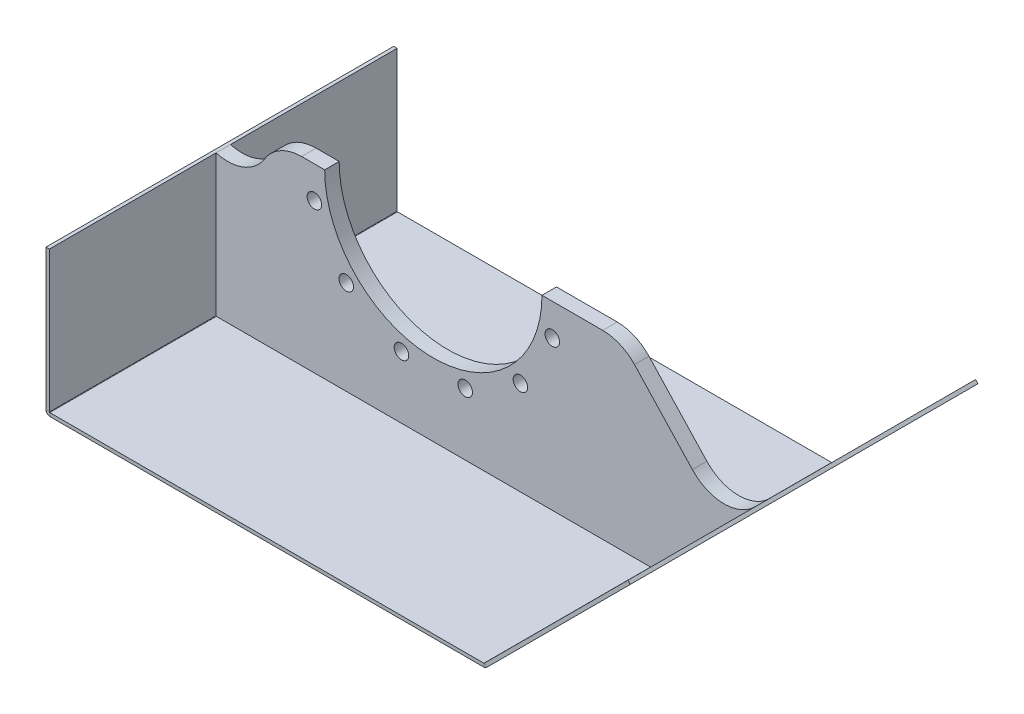
from build123d import *

# Parameters (mm, degrees)
SKETCH1_R                    = 241.3
SKETCH1_R_2                  = 190.5
SKETCH1_R_3                  = 12.7
BOSS_EXTRUDE1_DEPTH          = 25.4
SKETCH19_W                   = 762
SKETCH19_H                   = 609.6
BASE_FLANGE1_DEPTH           = 6
EDGE_FLANGE1_STRIP_CUT_DEPTH = 609.6
EDGE_FLANGE1_DEPTH           = 609.6
EDGE_FLANGE2_STRIP_W         = 25.4732
EDGE_FLANGE2_STRIP_H         = 6
EDGE_FLANGE2_STRIP_CUT_DEPTH = 609.6
EDGE_FLANGE2_DEPTH           = 609.6
BOSS_EXTRUDE2_DEPTH          = 12.7
BOSS_EXTRUDE2_DEPTH_BACK     = 12.7
FILLET1_R                    = 76.2
SKETCH30_R                   = 12.7
CUT_EXTRUDE1_DEPTH           = 783.174585068
FILLET3_R                    = 76.2


# Sheet-metal steps are written as plain solids
with BuildPart() as part:
    # Sketch1 → Boss-Extrude1 (new body)
    with BuildSketch(Plane.XY):
        Circle(SKETCH1_R)
        Circle(SKETCH1_R_2, mode=Mode.SUBTRACT)
        with Locations((55.879031838, 208.543385896)):
            Circle(SKETCH1_R_3, mode=Mode.SUBTRACT)
        with Locations((152.664354058, 152.664354058)):
            Circle(SKETCH1_R_3, mode=Mode.SUBTRACT)
        with Locations((208.543385896, 55.879031838)):
            Circle(SKETCH1_R_3, mode=Mode.SUBTRACT)
        with Locations((208.543385896, -55.879031838)):
            Circle(SKETCH1_R_3, mode=Mode.SUBTRACT)
        with Locations((152.664354058, -152.664354058)):
            Circle(SKETCH1_R_3, mode=Mode.SUBTRACT)
        with Locations((55.879031838, -208.543385896)):
            Circle(SKETCH1_R_3, mode=Mode.SUBTRACT)
        with Locations((-55.879031838, -208.543385896)):
            Circle(SKETCH1_R_3, mode=Mode.SUBTRACT)
        with Locations((-152.664354058, -152.664354058)):
            Circle(SKETCH1_R_3, mode=Mode.SUBTRACT)
        with Locations((-208.543385896, -55.879031838)):
            Circle(SKETCH1_R_3, mode=Mode.SUBTRACT)
        with Locations((-208.543385896, 55.879031838)):
            Circle(SKETCH1_R_3, mode=Mode.SUBTRACT)
        with Locations((-152.664354058, 152.664354058)):
            Circle(SKETCH1_R_3, mode=Mode.SUBTRACT)
        with Locations((-55.879031838, 208.543385896)):
            Circle(SKETCH1_R_3, mode=Mode.SUBTRACT)
    extrude(amount=BOSS_EXTRUDE1_DEPTH)



with BuildPart() as body_2:
    # Sketch19 → Base-Flange1 (new body)
    with BuildSketch(Plane(origin=(0, -317.5, 0), x_dir=(1, 0, 0), z_dir=(0, 1, 0))):
        with Locations((0, -12.7)):
            Rectangle(SKETCH19_W, SKETCH19_H)
    extrude(amount=-BASE_FLANGE1_DEPTH)

    # Edge-Flange1 strip (across the edge) → Edge-Flange1 strip cut (cut)
    with BuildSketch(Plane(origin=(381, -317.5, 317.5), x_dir=(-0.7071067811865438, 0.7071067811865512, 0), z_dir=(0, 0, -1))):
        Polygon((-22.039168001, 13.553886626), (-4.026895542, -4.458385832), (0.215745145, -0.215745145), (-17.796527314, 17.796527314), align=None)
    extrude(amount=EDGE_FLANGE1_STRIP_CUT_DEPTH, mode=Mode.SUBTRACT)

    # Edge-Flange1 section (across the edge) → Edge-Flange1 (add)
    with BuildSketch(Plane(origin=(381, -317.5, 317.5), x_dir=(-0.7071067811865438, 0.7071067811865512, 0), z_dir=(0, 0, -1))):
        with BuildLine():
            Line((-6, 0.30510971), (-6, 356.670718626))
            Line((-6, 356.670718626), (0, 356.670718626))
            Line((0, 356.670718626), (0, 0.30510971))
            ThreePointArc((0, 0.30510971), (0.056070336, 0.023225094), (0.215745145, -0.215745145))
            Line((0.215745145, -0.215745145), (-4.026895542, -4.458385832))
            ThreePointArc((-4.026895542, -4.458385832), (-5.487206859, -2.2728755), (-6, 0.30510971))
        make_face()
    extrude(amount=EDGE_FLANGE1_DEPTH)

    # Edge-Flange2 strip (across the edge) → Edge-Flange2 strip cut (cut)
    with BuildSketch(Plane(origin=(-381, -317.5, -292.1), x_dir=(1, 0, 0), z_dir=(0, 0, 1))):
        with Locations((-12, -3)):
            Rectangle(EDGE_FLANGE2_STRIP_W, EDGE_FLANGE2_STRIP_H)
    extrude(amount=EDGE_FLANGE2_STRIP_CUT_DEPTH, mode=Mode.SUBTRACT)

    # Edge-Flange2 section (across the edge) → Edge-Flange2 (add)
    with BuildSketch(Plane(origin=(-381, -317.5, -292.1), x_dir=(1, 0, 0), z_dir=(0, 0, 1))):
        with BuildLine():
            Line((-6, 0.7366), (-6, 248))
            Line((-6, 248), (0, 248))
            Line((0, 248), (0, 0.7366))
            ThreePointArc((0, 0.7366), (0.215745145, 0.215745145), (0.7366, 0))
            Line((0.7366, 0), (0.7366, -6))
            ThreePointArc((0.7366, -6), (-4.026895542, -4.026895542), (-6, 0.7366))
        make_face()
    extrude(amount=EDGE_FLANGE2_DEPTH)


with BuildPart() as part_1:
    add(part.part)

    add(body_2.part)  # Boss-Extrude2 merges body 2
    # Sketch2 → Boss-Extrude2 (add, two sides: drawn at the far end of the back side and taken through both)
    with BuildSketch(Plane(origin=(0, 0, 12.7), x_dir=(-1, 0, 0), z_dir=(0, 0, -1)).offset(-BOSS_EXTRUDE2_DEPTH_BACK)):
        with BuildLine():
            Line((-176.371629871, 164.677679655), (-508, -190.5))
            Line((-508, -190.5), (-381, -317.5))
            Line((-381, -317.5), (381, -317.5))
            Line((381, -317.5), (381, -190.5))
            Line((381, -190.5), (211.187529283, 116.728391899))
            ThreePointArc((211.187529283, 116.728391899), (-29.628031694, -239.474152547), (-176.371629871, 164.677679655))
        make_face()
    extrude(amount=BOSS_EXTRUDE2_DEPTH + BOSS_EXTRUDE2_DEPTH_BACK)

    # Fillet1
    # the kernel refuses this fillet: 76.2 mm, written as the material it adds along each edge
    with BuildSketch(Plane(origin=(-381, -190.5, 0), x_dir=(0, 1, 0), z_dir=(0, 0, 1))) as fillet1_piece_1:
        with BuildLine():
            CenterArc((194.419807723, -20.395387566), FILLET1_R, 164.475167034, 76.594355804)
            Line((157.558210281, -87.086186287), (156.820978332, -88.420002261))
            Line((156.820978332, -88.420002261), (-0.737231949, -1.333815974))
            Line((-0.737231949, -1.333815974), (0, 1.524))
            ThreePointArc((0, 1.524), (60.5, 1.524), (119.531603846, 0.407907751))
            Line((119.531603846, 0.407907751), (121, 0))
        make_face()
    extrude(amount=25.4)
    with BuildSketch(Plane(origin=(508, -190.5, 25.4), x_dir=(0.7071067811865509, 0.707106781186544, 0), z_dir=(0, 0, -1))) as fillet1_piece_2:
        with BuildLine():
            CenterArc((FILLET1_R * 1.03487581695, -FILLET1_R), FILLET1_R, 90, 91.963796982)
            Line((FILLET1_R * 0.0354631377737, -FILLET1_R * 1.03426801283), (FILLET1_R * 0.0154748841901, -FILLET1_R * 1.03495337309))
            Line((FILLET1_R * 0.0154748841901, -FILLET1_R * 1.03495337309), (-FILLET1_R * 0.020697516339, FILLET1_R * 0.02))
            Line((-FILLET1_R * 0.020697516339, FILLET1_R * 0.02), (FILLET1_R * 1.03487581695, FILLET1_R * 0.02))
            Line((FILLET1_R * 1.03487581695, FILLET1_R * 0.02), (FILLET1_R * 1.03487581695, 0))
        make_face()
    extrude(amount=25.4)

    # Sketch30 → Cut-Extrude1 (cut, through all)
    # profile 1 of 3: a face of its own
    with BuildSketch(Plane(origin=(0, 0, 0), x_dir=(-1, 0, 0), z_dir=(0, 0, -1))):
        with BuildLine():
            Line((-330.130702101, 0), (-241.3, 0))
            ThreePointArc((-241.3, 0), (-224.481808047, 88.507671171), (-176.371629871, 164.677679655))
            Line((-176.371629871, 164.677679655), (-330.130702101, 0))
        make_face()
    # profile 2 of 3: a face of its own
    with BuildSketch(Plane(origin=(0, 0, 0), x_dir=(-1, 0, 0), z_dir=(0, 0, -1))):
        with BuildLine():
            Line((-241.3, 0), (-190.5, 0))
            ThreePointArc((-190.5, 0), (0, 190.5), (190.5, 0))
            Line((190.5, 0), (241.3, 0))
            ThreePointArc((241.3, 0), (233.650637508, 60.274949954), (211.187529283, 116.728391899))
            ThreePointArc((211.187529283, 116.728391899), (29.628031694, 239.474152547), (-176.371629871, 164.677679655))
            ThreePointArc((-176.371629871, 164.677679655), (-224.481808047, 88.507671171), (-241.3, 0))
        make_face()
        with Locations((-208.543385896, 55.879031838)):
            Circle(SKETCH30_R, mode=Mode.SUBTRACT)
        with Locations((-152.664354058, 152.664354058)):
            Circle(SKETCH30_R, mode=Mode.SUBTRACT)
        with Locations((-55.879031838, 208.543385896)):
            Circle(SKETCH30_R, mode=Mode.SUBTRACT)
        with Locations((208.543385896, 55.879031838)):
            Circle(SKETCH30_R, mode=Mode.SUBTRACT)
        with Locations((55.879031838, 208.543385896)):
            Circle(SKETCH30_R, mode=Mode.SUBTRACT)
        with Locations((152.664354058, 152.664354058)):
            Circle(SKETCH30_R, mode=Mode.SUBTRACT)
    # profile 3 of 3: a face of its own
    with BuildSketch(Plane(origin=(0, 0, 0), x_dir=(-1, 0, 0), z_dir=(0, 0, -1))):
        with BuildLine():
            ThreePointArc((211.187529283, 116.728391899), (233.650637508, 60.274949954), (241.3, 0))
            Line((241.3, 0), (275.706099682, 0))
            Line((275.706099682, 0), (211.187529283, 116.728391899))
        make_face()
    extrude(amount=-CUT_EXTRUDE1_DEPTH, mode=Mode.SUBTRACT)

    # Fillet3
    fillet3_edges = [part_1.edges().sort_by_distance(p)[0] for p in [
        (-275.706099682, 0, 12.7),
        (330.130702101, 0, 12.7),
    ]]
    fillet(fillet3_edges, radius=FILLET3_R)


solid = part_1.part
